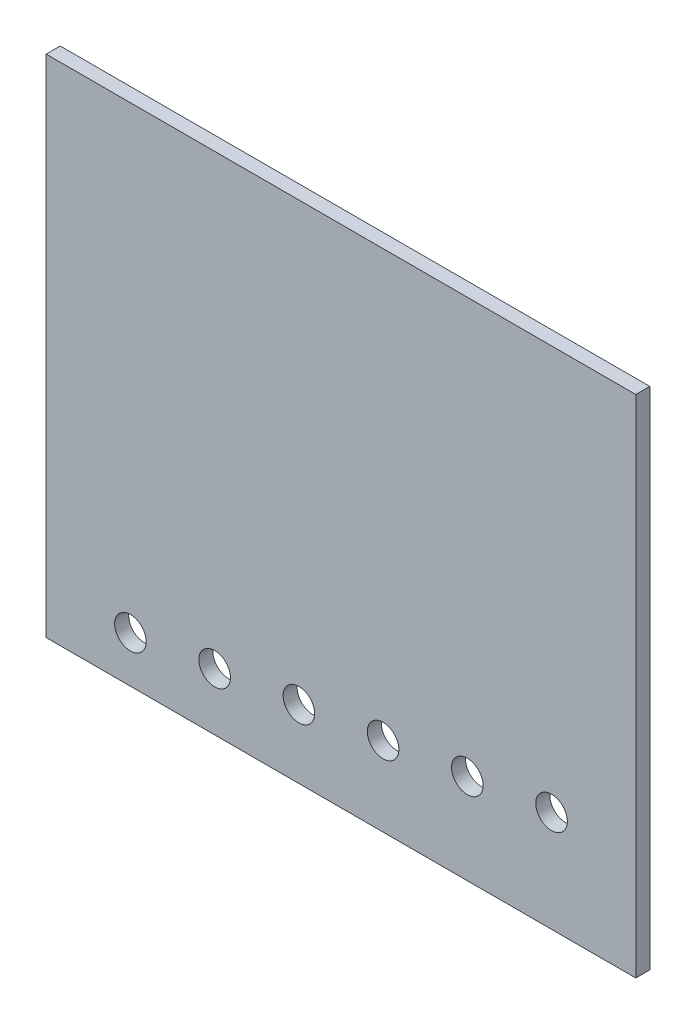
from build123d import *

# Parameters (mm, degrees)
SKETCH1_W           = 533.4
SKETCH1_H           = 457.2
BOSS_EXTRUDE4_DEPTH = 12.7
SKETCH3_R           = 14.2875
CUT_EXTRUDE2_DEPTH  = 12.7


with BuildPart() as part:
    # Sketch1 → Boss-Extrude4 (new body)
    with BuildSketch(Plane.XY):
        Rectangle(SKETCH1_W, SKETCH1_H)
    extrude(amount=BOSS_EXTRUDE4_DEPTH)

    # Sketch3 → Cut-Extrude2 (cut)
    with BuildSketch(Plane(origin=(0, 0, 0), x_dir=(-1, 0, 0), z_dir=(0, 0, -1))):
        with Locations((-190.5, -136.944186205)):
            Circle(SKETCH3_R)
        with Locations((-114.3, -146.88837241)):
            Circle(SKETCH3_R)
        with Locations((-38.1, -156.832558615)):
            Circle(SKETCH3_R)
        with Locations((38.1, -166.77674482)):
            Circle(SKETCH3_R)
        with Locations((114.3, -176.720931025)):
            Circle(SKETCH3_R)
        with Locations((190.5, -186.66511723)):
            Circle(SKETCH3_R)
    extrude(amount=-CUT_EXTRUDE2_DEPTH, mode=Mode.SUBTRACT)


solid = part.part
